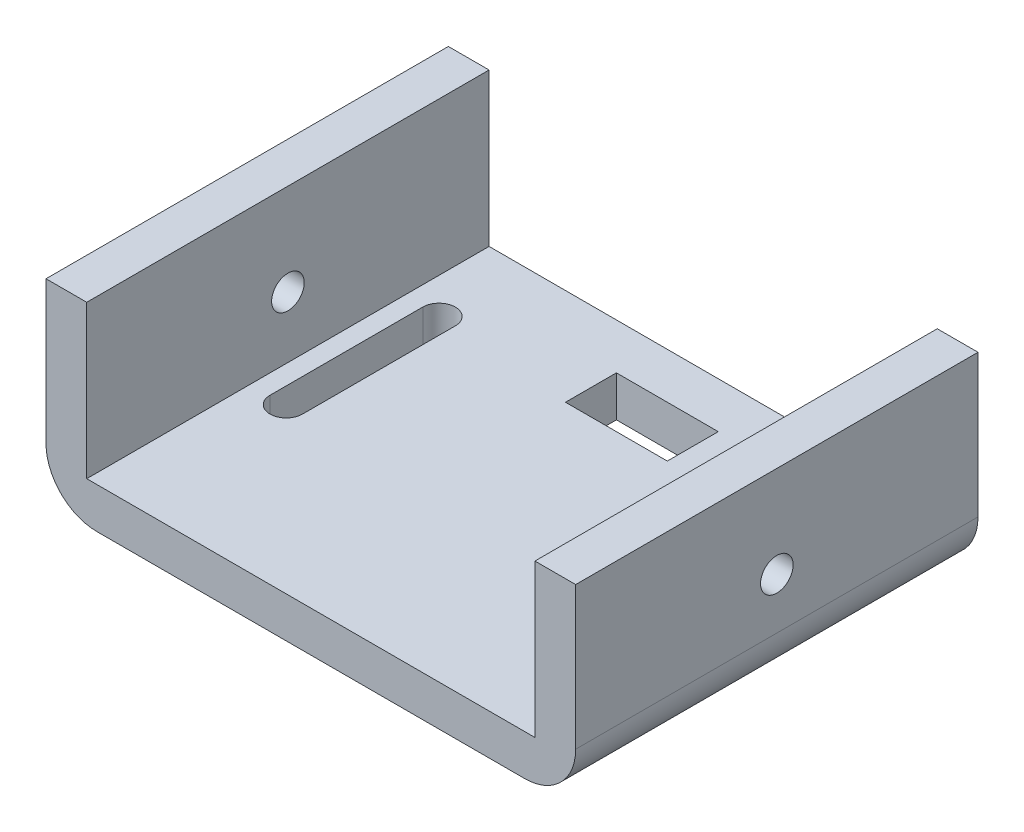
from build123d import *

# Parameters (mm, degrees)
BOSS_EXTRU_1_DEPTH      = 39.5
ESQUISSE3_W             = 10
ESQUISSE3_H             = 5
ENL_V_MAT_EXTRU_1_DEPTH = 51.963222033
CUT_EXTRUDE1_DEPTH      = 64.947243881
CUT_EXTRUDE1_DEPTH_BACK = 64.947243881
SKETCH1_R               = 1.6
CUT_EXTRUDE2_DEPTH      = 51.963222033
FILLET1_R               = 5


with BuildPart() as part:
    # Esquisse1 → Boss.-Extru.1 (new body)
    with BuildSketch(Plane.XY):
        Polygon((-22, 0), (22, 0), (22, 15), (26, 15), (26, -4), (-26, -4), (-26, 15), (-22, 15), align=None)
    extrude(amount=BOSS_EXTRU_1_DEPTH)

    # Esquisse3 → Enlèv. mat.-Extru.1 (cut, through all)
    with BuildSketch(Plane.XZ.offset(4)):
        with Locations((0, 7)):
            Rectangle(ESQUISSE3_W, ESQUISSE3_H)
    extrude(amount=-ENL_V_MAT_EXTRU_1_DEPTH, mode=Mode.SUBTRACT)

    # Sketch1 → Cut-Extrude1 (cut, two sides: drawn at the far end of the back side and taken through both)
    with BuildSketch(Plane(origin=(-22, 0, 0), x_dir=(0, 0, -1), z_dir=(1, 0, 0)).offset(-CUT_EXTRUDE1_DEPTH_BACK)):
        with Locations((-19.75, 6)):
            Circle(SKETCH1_R)
    extrude(amount=CUT_EXTRUDE1_DEPTH + CUT_EXTRUDE1_DEPTH_BACK, mode=Mode.SUBTRACT)

    # Sketch2 → Cut-Extrude2 (cut, through all)
    with BuildSketch(Plane.XZ.offset(4)):
        with BuildLine():
            Line((-16.9, 23.411197819), (-16.9, 8.411197819))
            ThreePointArc((-16.9, 8.411197819), (-18.5, 6.811197819), (-20.1, 8.411197819))
            Line((-20.1, 8.411197819), (-20.1, 23.411197819))
            ThreePointArc((-20.1, 23.411197819), (-18.5, 25.011197819), (-16.9, 23.411197819))
        make_face()
        with BuildLine():
            Line((20.1, 23.411197819), (20.1, 8.411197819))
            ThreePointArc((20.1, 8.411197819), (18.5, 6.811197819), (16.9, 8.411197819))
            Line((16.9, 8.411197819), (16.9, 23.411197819))
            ThreePointArc((16.9, 23.411197819), (18.5, 25.011197819), (20.1, 23.411197819))
        make_face()
    extrude(amount=-CUT_EXTRUDE2_DEPTH, mode=Mode.SUBTRACT)

    # Fillet1
    fillet1_edges = [part.edges().sort_by_distance(p)[0] for p in [
        (26, -4, 19.75),
        (-26, -4, 19.75),
    ]]
    fillet(fillet1_edges, radius=FILLET1_R)


solid = part.part
